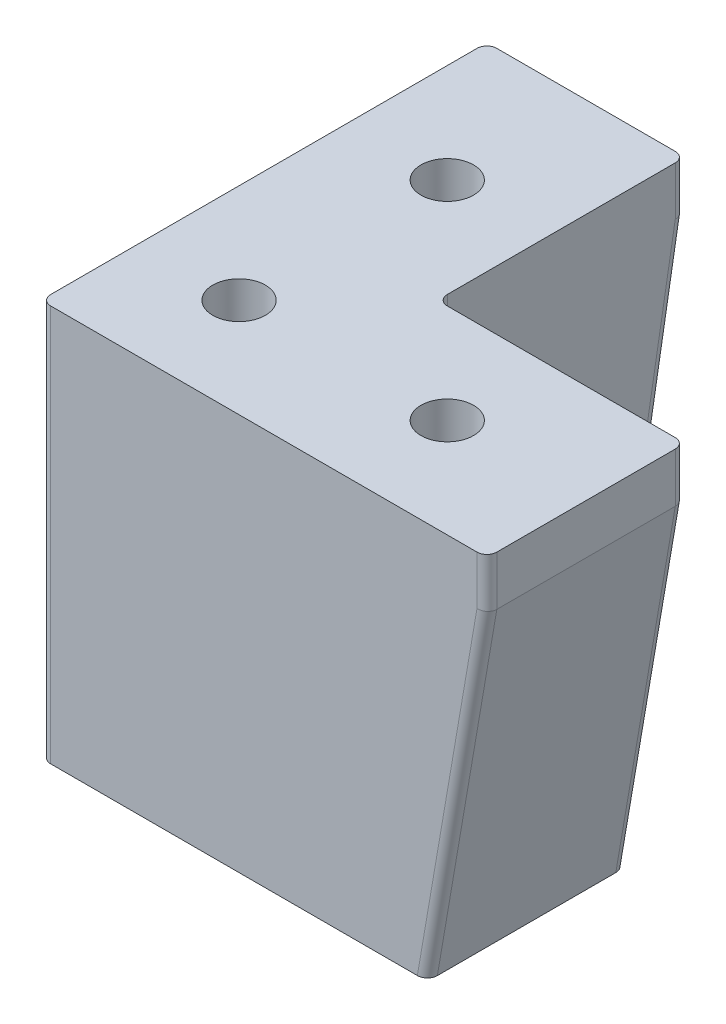
from build123d import *

# Parameters (mm, degrees)
BOSS_EXTRUDE1_DEPTH  = 5
SKETCH6_R            = 5
CUT_EXTRUDE2_DEPTH   = 35
M5_CLEARANCE_HOLE1_D = 5.3
FILLET2_R            = 1
CUT_EXTRUDE6_START   = -40
CUT_EXTRUDE6_DEPTH   = 0.4


# Read off the part's stored shape, not the designer's step: Cut-Extrude6
with BuildPart() as part:
    # Sketch1 → Boss-Extrude1 (new body)
    with BuildSketch(Plane(origin=(0, 0, 0), x_dir=(1, 0, 0), z_dir=(0, 1, 0))):
        Polygon((0, 0), (45, 0), (45, 20), (20, 20), (20, 45), (0, 45), align=None)
    extrude(amount=-BOSS_EXTRUDE1_DEPTH)

    # Sketch5 → section 1 of loft1
    with BuildSketch(Plane(origin=(0, -40, 0), x_dir=(1, 0, 0), z_dir=(0, 1, 0)), mode=Mode.PRIVATE) as loft1_s1:
        with BuildLine():
            Line((0, 0), (39, 0))
            Line((39, 0), (39, 20))
            Line((39, 20), (20, 20))
            Line((20, 20), (20, 39))
            Line((20, 39), (0, 39))
            Line((0, 39), (0, 0))
        make_face()
    # loft from a face of the part (loft1)
    loft([part.faces().sort_by_distance((18.035714286, -5, -18.035714286))[0], loft1_s1.sketch])

    # Sketch6 → Cut-Extrude2 (cut)
    with BuildSketch(Plane.XZ.offset(40)):
        with Locations(Location((31, -10, 0), (0, 0, 270))):
            Circle(SKETCH6_R)
        with Locations(Location((10, -10, 0), (0, 0, 270))):
            Circle(SKETCH6_R)
        with Locations(Location((10, -31, 0), (0, 0, 270))):
            Circle(SKETCH6_R)
    extrude(amount=-CUT_EXTRUDE2_DEPTH, mode=Mode.SUBTRACT)

    # M5 Clearance Hole1 (through all)
    with Locations(Plane(origin=(0, -5, 0), x_dir=(-1, 0, 0), z_dir=(0, -1, 0))):
        with Locations((-10, 10), (-31, 10), (-10, 31)):
            Hole(M5_CLEARANCE_HOLE1_D / 2)

    # Fillet2
    fillet2_edges = [part.edges().sort_by_distance(p)[0] for p in [
        (42, -22.5, 0),
        (42, -22.5, -20),
        (20, -20, -20),
        (20, -22.5, -42),
        (0, -22.5, -42),
        (0, -20, 0),
        (0, -2.5, -45),
        (20, -2.5, -45),
        (45, -2.5, -20),
        (45, -2.5, 0),
    ]]
    fillet(fillet2_edges, radius=FILLET2_R)

    # Cut-Extrude6 outline → Cut-Extrude6 (cut)
    # profile 1 of 5: a face of its own
    with BuildSketch(Plane(origin=(0, 0, 0), x_dir=(1, 0, 0), z_dir=(0, 1, 0)).offset(CUT_EXTRUDE6_START)):
        with BuildLine():
            add(Edge.make_bspline(
                [(8.049492521, 23.105128205), (8.078380833, 23.104367158), (8.135314149, 23.102867281), (8.218732459, 23.089379402), (8.299511148, 23.069563031), (8.376651447, 23.039019881), (8.451670554, 23.002323412), (8.522287657, 22.955440966), (8.590909921, 22.901866642), (8.655184348, 22.839723053), (8.714069703, 22.77150094), (8.766228193, 22.699417935), (8.809818648, 22.623157944), (8.845552133, 22.543038775), (8.873583329, 22.459284776), (8.893006558, 22.371733691), (8.905201564, 22.280627503), (8.906851562, 22.218417465), (8.907692308, 22.18671875)],
                knots=[0, 0, 0, 0, 0.061969039, 0.122129076, 0.180999124, 0.240162417, 0.299864723, 0.359951267, 0.421741789, 0.486545679, 0.551508471, 0.614994937, 0.677239666, 0.73971468, 0.803038538, 0.866487293, 0.93196948, 1, 1, 1, 1], degree=3))
            add(Edge.make_bspline(
                [(8.907692308, 22.18671875), (8.906827721, 22.153612929), (8.905129815, 22.088598563), (8.893245358, 21.993146199), (8.872762468, 21.90207867), (8.844680859, 21.815211631), (8.809325891, 21.732461386), (8.764440098, 21.654576163), (8.711775985, 21.580844894), (8.651741772, 21.511402999), (8.58458639, 21.447596793), (8.510647271, 21.390357441), (8.429443452, 21.341538325), (8.342809082, 21.298262376), (8.248440661, 21.26514987), (8.148624952, 21.236845618), (8.041943813, 21.216284672), (7.968442924, 21.209191328), (7.930769231, 21.205555556)],
                knots=[0, 0, 0, 0, 0.064450804, 0.126570737, 0.18692234, 0.245923829, 0.304098129, 0.361780924, 0.420576707, 0.480272295, 0.540223572, 0.600657929, 0.661916152, 0.724434637, 0.788852535, 0.856286704, 0.926338162, 1, 1, 1, 1], degree=3))
            Line((7.930769231, 21.205555556), (7.930769231, 20.825641026))
            add(Edge.make_bspline(
                [(7.930769231, 20.825641026), (7.98117141, 20.828116684), (8.080159949, 20.832978813), (8.224481539, 20.85575804), (8.362446258, 20.888322089), (8.49287131, 20.934472943), (8.617314733, 20.991465215), (8.734124061, 21.061240248), (8.844458615, 21.142310552), (8.946229394, 21.234527401), (9.03926061, 21.334591181), (9.120447979, 21.441902355), (9.188258542, 21.555357966), (9.245254884, 21.673973949), (9.287985613, 21.799122134), (9.319705038, 21.929606242), (9.338785887, 22.06601605), (9.340837121, 22.158955782), (9.341880342, 22.206223291)],
                knots=[0, 0, 0, 0, 0.068798517, 0.135118456, 0.199001011, 0.261933701, 0.323531284, 0.385434721, 0.447215516, 0.510018103, 0.57251091, 0.633364022, 0.693216728, 0.752555388, 0.812558227, 0.873260859, 0.935542708, 1, 1, 1, 1], degree=3))
            add(Edge.make_bspline(
                [(9.341880342, 22.206223291), (9.340793637, 22.252642485), (9.338658302, 22.343854544), (9.320320676, 22.476977171), (9.291599818, 22.603707803), (9.251304028, 22.723798721), (9.197136197, 22.83629177), (9.132066793, 22.942032024), (9.056810426, 23.042278338), (8.968208194, 23.132517019), (8.873620548, 23.215379172), (8.772639941, 23.286864757), (8.668343567, 23.348082583), (8.559936123, 23.399109587), (8.446396879, 23.436672726), (8.329378834, 23.46519113), (8.207670729, 23.481310954), (8.125294229, 23.483784943), (8.083413462, 23.485042735)],
                knots=[0, 0, 0, 0, 0.06947546, 0.136516798, 0.200788824, 0.263829673, 0.325735023, 0.387290692, 0.449509219, 0.51296782, 0.576275215, 0.6375801, 0.697902606, 0.757172088, 0.816598528, 0.876653171, 0.937289642, 1, 1, 1, 1], degree=3))
            add(Edge.make_bspline(
                [(8.083413462, 23.485042735), (8.024451795, 23.482994693), (7.907563156, 23.47893455), (7.735792798, 23.444203828), (7.569370281, 23.389960905), (7.435430878, 23.324649816), (7.327500843, 23.258764098), (7.238638695, 23.199391589), (7.142958747, 23.129886532), (7.040781396, 23.049237301), (6.931306302, 22.959112208), (6.814599597, 22.858694925), (6.691867075, 22.74726938), (6.6080403, 22.669063384), (6.564603365, 22.628538996)],
                knots=[0, 0, 0, 0, 0.098702196, 0.195672309, 0.292422427, 0.391342544, 0.444462441, 0.504228775, 0.570352338, 0.642545753, 0.722287505, 0.807921123, 0.900469538, 1, 1, 1, 1], degree=3))
            Line((6.564603365, 22.628538996), (5.434188034, 21.569357639))
            Line((5.434188034, 21.569357639), (5.434188034, 23.539316239))
            Line((5.434188034, 23.539316239), (5, 23.539316239))
            Line((5, 23.539316239), (5, 20.662820513))
            Line((5, 20.662820513), (6.75201656, 22.304594017))
            add(Edge.make_bspline(
                [(6.75201656, 22.304594017), (6.793740807, 22.344569053), (6.873884547, 22.421352916), (6.990927403, 22.529909848), (7.099382181, 22.627568263), (7.199729469, 22.714392943), (7.291400393, 22.790455328), (7.375113356, 22.855512052), (7.450149958, 22.909850654), (7.53829982, 22.967438248), (7.646053309, 23.02235184), (7.77707134, 23.070615269), (7.912242391, 23.099833292), (8.003559322, 23.103356168), (8.049492521, 23.105128205)],
                knots=[0, 0, 0, 0, 0.110794173, 0.212812933, 0.30607791, 0.390617458, 0.467232727, 0.534450618, 0.593866801, 0.644832969, 0.736220619, 0.825037402, 0.911992313, 1, 1, 1, 1], degree=3))
        make_face()
    # profile 2 of 5: a face of its own
    with BuildSketch(Plane(origin=(0, 0, 0), x_dir=(1, 0, 0), z_dir=(0, 1, 0)).offset(CUT_EXTRUDE6_START)):
        with BuildLine():
            add(Edge.make_bspline(
                [(7.11497062, 20.282905983), (7.050232421, 20.282116902), (6.92409268, 20.28057941), (6.73959949, 20.272635764), (6.565442177, 20.256914712), (6.401135954, 20.237470252), (6.247656361, 20.209771885), (6.103543991, 20.178283724), (5.970042511, 20.13914732), (5.845801369, 20.095139745), (5.731242355, 20.044572729), (5.623648942, 19.990429361), (5.523601292, 19.930837162), (5.430124501, 19.867499184), (5.344184474, 19.799531721), (5.265568815, 19.727033074), (5.194329377, 19.649948063), (5.130596523, 19.56846658), (5.074860284, 19.483290763), (5.025041051, 19.396246097), (4.984615833, 19.305595245), (4.950484037, 19.213352852), (4.9239091, 19.118648549), (4.90571342, 19.02157523), (4.892916727, 18.922450804), (4.891942593, 18.855440807), (4.891452991, 18.821761485)],
                knots=[0, 0, 0, 0, 0.065054434, 0.126755912, 0.185490514, 0.24073191, 0.29293992, 0.342140701, 0.388881863, 0.432635575, 0.474482647, 0.514623441, 0.553593506, 0.591408872, 0.628005603, 0.663582889, 0.698758803, 0.733361246, 0.767393593, 0.800968901, 0.834019894, 0.866998799, 0.89973339, 0.932711072, 0.966180487, 1, 1, 1, 1], degree=3))
            add(Edge.make_bspline(
                [(4.891452991, 18.821761485), (4.892019784, 18.788374457), (4.893137389, 18.722541754), (4.904605119, 18.624979098), (4.923305123, 18.530070529), (4.948699635, 18.437626317), (4.980974555, 18.347457275), (5.022027057, 18.260446696), (5.069641573, 18.17544547), (5.123811996, 18.092841461), (5.185889889, 18.014209052), (5.254546195, 17.939097724), (5.331502955, 17.86940401), (5.415528356, 17.804512692), (5.505909444, 17.742934354), (5.60353654, 17.68598413), (5.709044886, 17.634754227), (5.821639204, 17.586542133), (5.944018759, 17.544043263), (6.077362198, 17.506786341), (6.222407142, 17.475727484), (6.378722998, 17.450749791), (6.546426762, 17.430158196), (6.725813708, 17.416218741), (6.916729067, 17.407570859), (7.047684246, 17.406804183), (7.11497062, 17.406410256)],
                knots=[0, 0, 0, 0, 0.033789202, 0.066625711, 0.099290918, 0.131644991, 0.163601723, 0.19612244, 0.228922763, 0.262180588, 0.296015812, 0.330244518, 0.365088617, 0.400981712, 0.437653588, 0.475743052, 0.51529147, 0.556326816, 0.599680742, 0.646342906, 0.696412977, 0.749766296, 0.80656154, 0.867427467, 0.93188261, 1, 1, 1, 1], degree=3))
            add(Edge.make_bspline(
                [(7.11497062, 17.406410256), (7.182821746, 17.406807002), (7.314623536, 17.407577687), (7.506677341, 17.416151301), (7.686848358, 17.430393857), (7.855145207, 17.449912396), (8.01161135, 17.473664991), (8.155828596, 17.505373281), (8.288464608, 17.541432458), (8.409951298, 17.583224858), (8.521927472, 17.630380162), (8.626456444, 17.681710187), (8.723405505, 17.739224005), (8.81423109, 17.799732806), (8.897919541, 17.865447741), (8.974312373, 17.935675681), (9.043455714, 18.011113257), (9.106172486, 18.090268488), (9.16080679, 18.17364161), (9.210035929, 18.258662509), (9.250441294, 18.346831449), (9.283641536, 18.437344299), (9.31024405, 18.529937839), (9.328666239, 18.624994659), (9.340211999, 18.722537723), (9.341318951, 18.788373101), (9.341880342, 18.821761485)],
                knots=[0, 0, 0, 0, 0.068599052, 0.133254647, 0.194325134, 0.25129545, 0.304533104, 0.354257782, 0.40050645, 0.443439389, 0.484046125, 0.523286091, 0.561078603, 0.59793885, 0.633559399, 0.668550634, 0.702734162, 0.736926052, 0.770536038, 0.803433659, 0.836170733, 0.868451751, 0.900840135, 0.933462228, 0.966255396, 1, 1, 1, 1], degree=3))
            add(Edge.make_bspline(
                [(9.341880342, 18.821761485), (9.341290318, 18.855429159), (9.340116946, 18.92238357), (9.328839415, 19.021371452), (9.310126723, 19.118072496), (9.283612783, 19.212074435), (9.250718964, 19.304149419), (9.209489784, 19.393577264), (9.16149725, 19.480913449), (9.10510456, 19.564770082), (9.042230759, 19.64606776), (8.971155912, 19.722809582), (8.89259768, 19.795002533), (8.807396569, 19.863552664), (8.713918419, 19.926515149), (8.613789067, 19.986475395), (8.505257449, 20.040144429), (8.390134407, 20.091833036), (8.265234553, 20.136448725), (8.131261938, 20.176685041), (7.986634112, 20.209195793), (7.832109892, 20.236276151), (7.667121793, 20.257255216), (7.492023487, 20.272534697), (7.306699777, 20.280605952), (7.179992664, 20.282125962), (7.11497062, 20.282905983)],
                knots=[0, 0, 0, 0, 0.033788116, 0.067193932, 0.099862411, 0.132566612, 0.165151173, 0.197913187, 0.231319004, 0.265083278, 0.299255309, 0.334398567, 0.369942824, 0.406283561, 0.44406382, 0.482997707, 0.523354447, 0.56553659, 0.609612924, 0.656390811, 0.705885495, 0.7583245, 0.813831783, 0.872794559, 0.93472223, 1, 1, 1, 1], degree=3))
        make_face()
        with BuildLine():
            add(Edge.make_bspline(
                [(7.116666667, 19.902991453), (7.167555535, 19.902459475), (7.267117353, 19.901418685), (7.412776384, 19.894580596), (7.551362826, 19.883592355), (7.683002401, 19.868720012), (7.807460806, 19.848303431), (7.924916138, 19.823785148), (8.035336733, 19.795040276), (8.139007357, 19.76206905), (8.235555389, 19.724910935), (8.325191034, 19.683862359), (8.408389487, 19.640057967), (8.484911935, 19.592470913), (8.555103784, 19.541676556), (8.617557028, 19.486331604), (8.674207463, 19.428632056), (8.738871711, 19.347815071), (8.804804906, 19.242012838), (8.865481587, 19.110361435), (8.900325903, 18.973357894), (8.90523861, 18.880740478), (8.907692308, 18.834481838)],
                knots=[0, 0, 0, 0, 0.065683432, 0.128506729, 0.18816731, 0.245100247, 0.29944439, 0.350894442, 0.39992127, 0.446652922, 0.491237229, 0.533360472, 0.57383826, 0.612513132, 0.649585218, 0.685521345, 0.720096266, 0.75382929, 0.818919257, 0.880489397, 0.940309304, 1, 1, 1, 1], degree=3))
            add(Edge.make_bspline(
                [(8.907692308, 18.834481838), (8.90523839, 18.787658489), (8.900326085, 18.69392649), (8.865572957, 18.555528746), (8.80536982, 18.422939528), (8.738445937, 18.317986137), (8.675352203, 18.237271117), (8.620485652, 18.180275045), (8.560137246, 18.126989651), (8.494865954, 18.076840696), (8.424087418, 18.030717911), (8.347457464, 17.989520987), (8.265688945, 17.95118915), (8.177836912, 17.915991656), (8.081428804, 17.885440198), (7.975675515, 17.85813283), (7.858520989, 17.836729004), (7.73098397, 17.81805112), (7.592621718, 17.803810292), (7.443543271, 17.794100392), (7.283799938, 17.786736402), (7.173493574, 17.78646474), (7.116666667, 17.786324786)],
                knots=[0, 0, 0, 0, 0.060398231, 0.120906492, 0.182789759, 0.247550248, 0.281044758, 0.314839779, 0.349461206, 0.384842799, 0.420959358, 0.458335795, 0.497006764, 0.537441863, 0.580351082, 0.627413762, 0.678274955, 0.73393207, 0.793707046, 0.857686313, 0.92668377, 1, 1, 1, 1], degree=3))
            add(Edge.make_bspline(
                [(7.116666667, 17.786324786), (7.060123002, 17.78646926), (6.950382853, 17.786749656), (6.79091529, 17.794074775), (6.642179748, 17.804053626), (6.503987379, 17.816924532), (6.376805925, 17.836038563), (6.259760723, 17.857455382), (6.153471001, 17.883518186), (6.057208015, 17.914355425), (5.96933599, 17.949477514), (5.887575068, 17.987831366), (5.81093397, 18.029011438), (5.740191113, 18.075178665), (5.674642304, 18.125285875), (5.614475911, 18.179415348), (5.559954456, 18.237471886), (5.495259464, 18.317841166), (5.42761502, 18.423421067), (5.369435635, 18.557130096), (5.332636986, 18.694582058), (5.327970309, 18.787902641), (5.325641026, 18.834481838)],
                knots=[0, 0, 0, 0, 0.072955804, 0.14159289, 0.205939835, 0.265318588, 0.320618055, 0.371840652, 0.418816969, 0.461728715, 0.502166195, 0.540839439, 0.578218077, 0.614336762, 0.649720438, 0.684587067, 0.718648771, 0.752372873, 0.817640596, 0.879714265, 0.939961661, 1, 1, 1, 1], degree=3))
            add(Edge.make_bspline(
                [(5.325641026, 18.834481838), (5.32757358, 18.881360164), (5.331434697, 18.975020031), (5.368686504, 19.11185805), (5.424892518, 19.244700377), (5.491352834, 19.348806438), (5.554645194, 19.428009133), (5.608607674, 19.48475635), (5.669030485, 19.536840923), (5.734222967, 19.586240385), (5.805430638, 19.631548029), (5.882311086, 19.672748205), (5.965077806, 19.710344254), (6.022856443, 19.731763767), (6.052397169, 19.742715011)],
                knots=[0, 0, 0, 0, 0.112813401, 0.225393884, 0.339594815, 0.45967541, 0.52173519, 0.583925839, 0.648174145, 0.713881038, 0.781004455, 0.851450928, 0.924050693, 1, 1, 1, 1], degree=3))
            add(Edge.make_bspline(
                [(6.052397169, 19.742715011), (6.090170282, 19.755477625), (6.166865902, 19.781391206), (6.285839081, 19.814788304), (6.410665281, 19.841089882), (6.540598518, 19.864752239), (6.676597013, 19.880903078), (6.818239973, 19.893902814), (6.965634192, 19.90155993), (7.065776705, 19.902509106), (7.116666667, 19.902991453)],
                knots=[0, 0, 0, 0, 0.110588339, 0.224541754, 0.342503494, 0.464324098, 0.590756033, 0.722227475, 0.858842836, 1, 1, 1, 1], degree=3))
        make_face(mode=Mode.SUBTRACT)
    # profile 3 of 5: a face of its own
    with BuildSketch(Plane(origin=(0, 0, 0), x_dir=(1, 0, 0), z_dir=(0, 1, 0)).offset(CUT_EXTRUDE6_START)):
        Polygon((18.60042735, 5), (18.60042735, 9.233333333), (16.538034188, 9.233333333), (16.538034188, 8.799145299), (18.220512821, 8.799145299), (18.220512821, 7.496581197), (16.538034188, 7.496581197), (16.538034188, 7.062393162), (18.220512821, 7.062393162), (18.220512821, 5), align=None)
    # profile 4 of 5: a face of its own
    with BuildSketch(Plane(origin=(0, 0, 0), x_dir=(1, 0, 0), z_dir=(0, 1, 0)).offset(CUT_EXTRUDE6_START)):
        Polygon((21.314102564, 9.233333333), (20.934188034, 9.233333333), (20.934188034, 5.434188034), (19.305982906, 5.434188034), (19.305982906, 5), (21.314102564, 5), align=None)
    # profile 5 of 5: a face of its own
    with BuildSketch(Plane(origin=(0, 0, 0), x_dir=(1, 0, 0), z_dir=(0, 1, 0)).offset(CUT_EXTRUDE6_START)):
        Polygon((24.136324786, 9.233333333), (22.073931624, 9.233333333), (22.073931624, 8.799145299), (23.756410256, 8.799145299), (23.756410256, 7.496581197), (22.073931624, 7.496581197), (22.073931624, 7.062393162), (23.756410256, 7.062393162), (23.756410256, 5), (24.136324786, 5), align=None)
    extrude(amount=CUT_EXTRUDE6_DEPTH, mode=Mode.SUBTRACT)


solid = part.part
